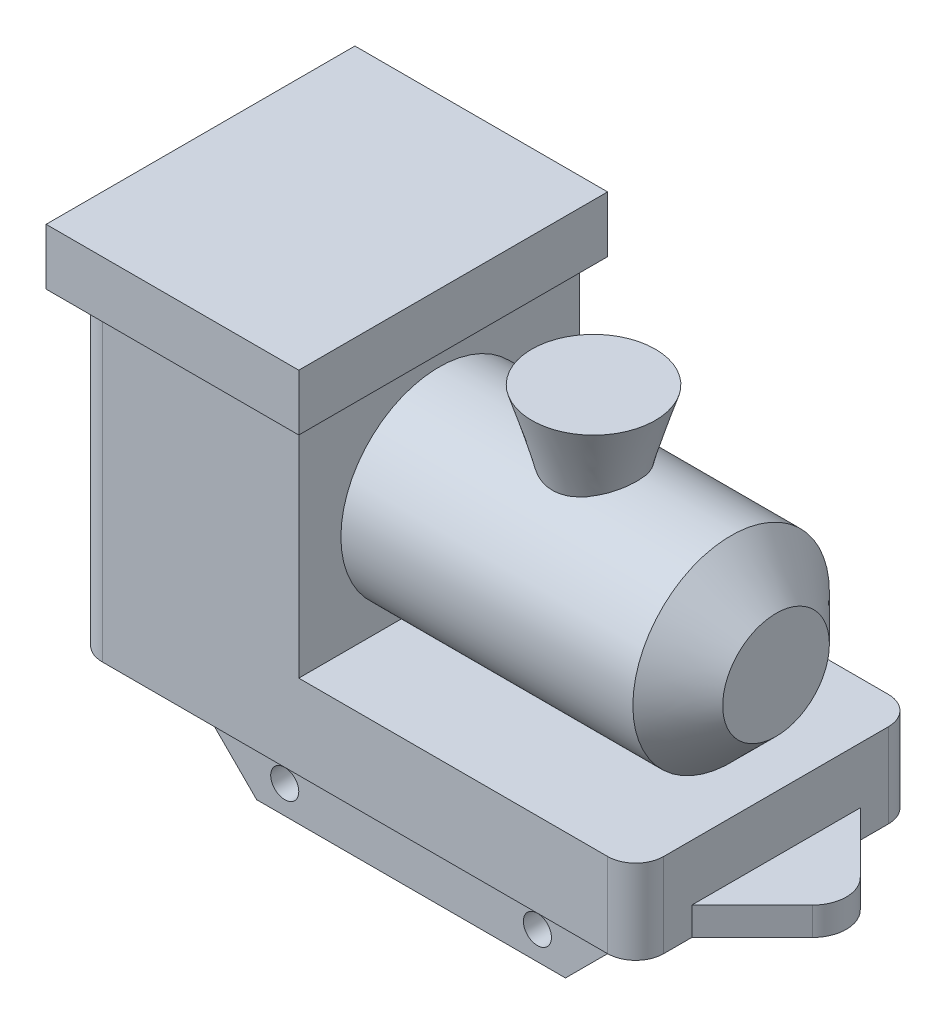
from build123d import *

# Parameters (mm, degrees)
SKETCH1_W           = 100
SKETCH1_H           = 50
BOSS_EXTRUDE1_DEPTH = 15
SHELL1_T            = -5
FILLET1_R           = 5
SKETCH2_R           = 2.5
BOSS_EXTRUDE2_DEPTH = 15
BOSS_EXTRUDE3_DEPTH = 5
BOSS_EXTRUDE4_START = 5
SKETCH4_R           = 3.5
BOSS_EXTRUDE4_DEPTH = 5
SKETCH5_W           = 90
SKETCH5_H           = 40
BOSS_EXTRUDE5_DEPTH = 10
BOSS_EXTRUDE6_START = 40
BOSS_EXTRUDE6_DEPTH = 40
SKETCH7_W           = 45
SKETCH7_H           = 55
BOSS_EXTRUDE7_DEPTH = 10
SKETCH8_R           = 17.5
BOSS_EXTRUDE8_DEPTH = 60
CHAMFER1_SIZE       = 8


with BuildPart() as part:
    # Sketch1 → Boss-Extrude1 (new body)
    with BuildSketch(Plane(origin=(0, 0, 0), x_dir=(1, 0, 0), z_dir=(0, 1, 0))):
        Rectangle(SKETCH1_W, SKETCH1_H)
    extrude(amount=BOSS_EXTRUDE1_DEPTH)

    # Shell1
    shell1_openings = [part.faces().sort_by_distance(p)[0] for p in [
        (0, 15, 0),
    ]]
    offset(amount=SHELL1_T, openings=shell1_openings, kind=Kind.INTERSECTION)

    # Fillet1
    fillet1_edges = [part.edges().sort_by_distance(p)[0] for p in [
        (50, 7.5, 25),
        (-50, 7.5, 25),
        (-50, 7.5, -25),
        (50, 7.5, -25),
    ]]
    fillet(fillet1_edges, radius=FILLET1_R)

    # Sketch2 → Boss-Extrude2 (add, symmetric)
    with BuildSketch(Plane.XY):
        Polygon((-45, 0), (-27.5, -17.5), (27.5, -17.5), (45, 0), align=None)
        with Locations((-22.5, -12.5)):
            Circle(SKETCH2_R, mode=Mode.SUBTRACT)
        with Locations((22.5, -12.5)):
            Circle(SKETCH2_R, mode=Mode.SUBTRACT)
    extrude(amount=BOSS_EXTRUDE2_DEPTH, both=True)

    # Sketch3 → Boss-Extrude3 (add)
    with BuildSketch(Plane(origin=(0, 0, 0), x_dir=(1, 0, 0), z_dir=(0, 1, 0))):
        with BuildLine():
            Line((50, 15), (60.757359313, 4.242640687))
            ThreePointArc((60.757359313, 4.242640687), (62.514718626, 0), (60.757359313, -4.242640687))
            Line((60.757359313, -4.242640687), (50, -15))
            Line((50, -15), (50, 15))
        make_face()
    extrude(amount=BOSS_EXTRUDE3_DEPTH)

    # Sketch4 → Boss-Extrude4 (add)
    with BuildSketch(Plane(origin=(0, 0, 0), x_dir=(1, 0, 0), z_dir=(0, 1, 0)).offset(BOSS_EXTRUDE4_START)):
        with BuildLine():
            Line((-50, 15), (-60.757359313, 4.242640687))
            ThreePointArc((-60.757359313, 4.242640687), (-62.514718626, 0), (-60.757359313, -4.242640687))
            Line((-60.757359313, -4.242640687), (-50, -15))
            Line((-50, -15), (-50, 15))
        make_face()
        with Locations(Location((-56.514718626, 0, 0), (0, 0, 90))):
            Circle(SKETCH4_R, mode=Mode.SUBTRACT)
    extrude(amount=BOSS_EXTRUDE4_DEPTH)

    # Sketch5 → Boss-Extrude5 (add)
    with BuildSketch(Plane(origin=(0, 5, 0), x_dir=(1, 0, 0), z_dir=(0, 1, 0))):
        Rectangle(SKETCH5_W, SKETCH5_H)
    extrude(amount=BOSS_EXTRUDE5_DEPTH)

    # Sketch6 → Boss-Extrude6 (add)
    with BuildSketch(Plane(origin=(0, 15, 0), x_dir=(1, 0, 0), z_dir=(0, 1, 0)).offset(BOSS_EXTRUDE6_START)):
        with BuildLine():
            Line((-45, -25), (-10, -25))
            Line((-10, -25), (-10, 25))
            Line((-10, 25), (-45, 25))
            ThreePointArc((-45, 25), (-48.535533906, 23.535533906), (-50, 20))
            Line((-50, 20), (-50, -20))
            ThreePointArc((-50, -20), (-48.535533906, -23.535533906), (-45, -25))
        make_face()
    extrude(amount=-BOSS_EXTRUDE6_DEPTH)

    # Sketch7 → Boss-Extrude7 (add)
    with BuildSketch(Plane(origin=(0, 55, 0), x_dir=(1, 0, 0), z_dir=(0, 1, 0))):
        with Locations((-30, 0)):
            Rectangle(SKETCH7_W, SKETCH7_H)
    extrude(amount=BOSS_EXTRUDE7_DEPTH)

    # Sketch8 → Boss-Extrude8 (add)
    with BuildSketch(Plane(origin=(-10, 0, 0), x_dir=(0, 0, -1), z_dir=(1, 0, 0))):
        with Locations(Location((0, 33, 0), (0, 0, 180))):
            Circle(SKETCH8_R)
    extrude(amount=BOSS_EXTRUDE8_DEPTH)

    # Chamfer1
    chamfer1_edges = [part.edges().sort_by_distance(p)[0] for p in [
        (50, 33, -17.5),
    ]]
    chamfer(chamfer1_edges, length=CHAMFER1_SIZE)


with BuildPart() as body_2:
    # Loft1: read off the stored shape, not the designer's step
    # Loft1: loft between two sections, ruled curve by curve
    loft1_from = [
        Edge.make_bspline([(20.846558371, 61.5, 10.478575622), (-0.110592873, 61.5, 17.171692365), (-6.803709615, 61.5, -3.785458879), (14.153441629, 61.5, -10.478575622), (35.110592873, 61.5, -17.171692365), (41.803709615, 61.5, 3.785458879), (20.846558371, 61.5, 10.478575622)], [0, 0, 0, 0, 0.5, 0.5, 0.5, 1, 1, 1, 1], 3, [1, 0.333333333, 0.333333333, 1, 0.333333333, 0.333333333, 1]),
    ]
    loft1_to = [
        Edge.make_bspline([(21.975509399, 47.5, 5.382361528), (11.210786342, 47.5, 14.333380326), (2.259767545, 47.5, 3.568657269), (13.024490601, 47.5, -5.382361528), (23.789213658, 47.5, -14.333380326), (32.740232455, 47.5, -3.568657269), (21.975509399, 47.5, 5.382361528)], [0, 0, 0, 0, 0.5, 0.5, 0.5, 1, 1, 1, 1], 3, [1, 0.333333333, 0.333333333, 1, 0.333333333, 0.333333333, 1]),
    ]
    loft1 = Solid(Shell([*[Face.make_surface_from_curves(loft1_from[k], loft1_to[k]) for k in range(1)], Face(Wire(loft1_from)), Face(Wire(loft1_to))]))
    add(loft1)


solid = Compound([part.part, body_2.part])
